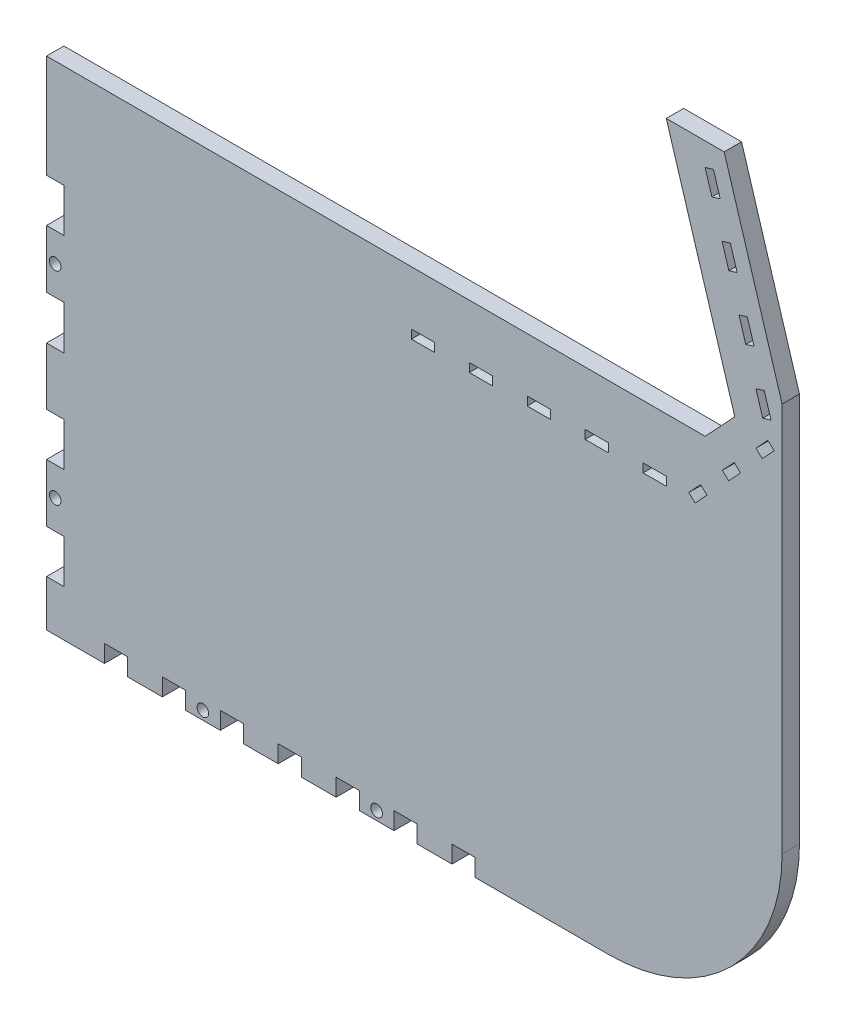
from build123d import *

# Parameters (mm, degrees)
ESQUISSE1_W              = 340
ESQUISSE1_H              = 260
BOSS_EXTRU_1_DEPTH       = 6
CONG_1_R                 = 60
ESQUISSE14_W             = 180
ESQUISSE14_H             = 10
ENL_V_MAT_EXTRU_7_DEPTH  = 10
ESQUISSE15_W             = 120
ESQUISSE15_H             = 2
ENL_V_MAT_EXTRU_8_DEPTH  = 10
CONG_2_R                 = 10
CONG_3_R                 = 8
ENL_V_MAT_EXTRU_10_DEPTH = 10
ESQUISSE18_W             = 8
ESQUISSE18_H             = 6
ENL_V_MAT_EXTRU_11_DEPTH = 10
ENL_V_MAT_EXTRU_13_DEPTH = 6
ENL_V_MAT_EXTRU_14_DEPTH = 10
ESQUISSE21_W             = 95
ESQUISSE21_H             = 171.650635095
ENL_V_MAT_EXTRU_15_DEPTH = 10
BOSS_EXTRU_3_DEPTH       = 6
ENL_V_MAT_EXTRU_18_DEPTH = 6
ESQUISSE25_W             = 8
ESQUISSE25_H             = 3
ENL_V_MAT_EXTRU_17_DEPTH = 6
ESQUISSE30_W             = 9
ESQUISSE30_H             = 171.650635095
BOSS_EXTRU_4_DEPTH       = 6
ESQUISSE32_W             = 6
ESQUISSE32_H             = 15
ESQUISSE32_H_2           = 15.174682453
ENL_V_MAT_EXTRU_19_DEPTH = 6
ESQUISSE33_R             = 2
ENL_V_MAT_EXTRU_20_DEPTH = 364.527165422


with BuildPart() as part:
    # Esquisse1 → Boss.-Extru.1 (new body)
    with BuildSketch(Plane.XY):
        with Locations((-170, 130)):
            Rectangle(ESQUISSE1_W, ESQUISSE1_H)
    extrude(amount=-BOSS_EXTRU_1_DEPTH)

    # Congé1
    cong_1_edges = [part.edges().sort_by_distance(p)[0] for p in [
        (0, 0, -3),
        (-340, 0, -3),
    ]]
    fillet(cong_1_edges, radius=CONG_1_R)

    # Esquisse14 → Enlèv. mat.-Extru.7 (cut)
    with BuildSketch(Plane(origin=(0, 0, -6), x_dir=(-1, 0, 0), z_dir=(0, 0, -1))):
        with Locations((235, 255)):
            Rectangle(ESQUISSE14_W, ESQUISSE14_H)
    extrude(amount=-ENL_V_MAT_EXTRU_7_DEPTH, mode=Mode.SUBTRACT)

    # Esquisse15 → Enlèv. mat.-Extru.8 (cut)
    with BuildSketch(Plane.XY):
        with Locations((-250, 249)):
            Rectangle(ESQUISSE15_W, ESQUISSE15_H)
    extrude(amount=-ENL_V_MAT_EXTRU_8_DEPTH, mode=Mode.SUBTRACT)

    # Congé2
    # the kernel refuses this fillet: 10 mm, written as the material it takes off along each edge
    with BuildSketch(Plane(origin=(-190, 250, 15), x_dir=(1, 0, 0), z_dir=(0, 0, -1))) as cong_2_piece_1:
        with BuildLine():
            CenterArc((6, 10), CONG_2_R, 233.130102354, 36.869897646)
            Line((0, 2), (-0.12, 1.84))
            ThreePointArc((-0.12, 1.84), (-0.2, 1), (-0.2, 0))
            Line((-0.2, 0), (0, -0.2))
            Line((0, -0.2), (6, -0.2))
            Line((6, -0.2), (6, 0))
        make_face()
    extrude(amount=36, mode=Mode.SUBTRACT)
    with BuildSketch(Plane(origin=(-310, 250, 15), x_dir=(0, -1, 0), z_dir=(0, 0, -1))) as cong_2_piece_2:
        with BuildLine():
            CenterArc((10, 6), CONG_2_R, 180, 36.869897646)
            Line((0, 6), (-0.2, 6))
            Line((-0.2, 6), (-0.2, 0))
            Line((-0.2, 0), (0, -0.2))
            ThreePointArc((0, -0.2), (1, -0.2), (1.84, -0.12))
            Line((1.84, -0.12), (2, 0))
        make_face()
    extrude(amount=36, mode=Mode.SUBTRACT)

    # Congé3
    cong_3_edges = [part.edges().sort_by_distance(p)[0] for p in [
        (-145, 260, -3),
        (-325, 260, -3),
    ]]
    fillet(cong_3_edges, radius=CONG_3_R)

    # Esquisse17 → Enlèv. mat.-Extru.10 (cut)
    with BuildSketch(Plane.XY):
        Polygon((-29.216285169, 245.39755551), (-23.478456633, 247.151785738), (-25.817430271, 254.802223786), (-31.555258806, 253.047993558), align=None)
        Polygon((-23.368851074, 226.271460391), (-17.631022538, 228.025690619), (-19.969996176, 235.676128667), (-25.707824712, 233.921898438), align=None)
        Polygon((-17.52141698, 207.145365271), (-11.783588444, 208.8995955), (-14.122562082, 216.550033547), (-19.860390617, 214.795803319), align=None)
        Polygon((-180, 150), (-30, 150), (-2.720065597, 179.254148065), (-9.568281369, 188.663047712), (-5.936154349, 189.77350038), (-8.275127987, 197.423938428), (-14.012956523, 195.6697082), (-13.538488979, 194.117794792), (-102.15398245, 315.868381088), (-205, 193.301270189), align=None)
    extrude(amount=-ENL_V_MAT_EXTRU_10_DEPTH, mode=Mode.SUBTRACT)

    # Esquisse18 → Enlèv. mat.-Extru.11 (cut)
    with BuildSketch(Plane.XY):
        with Locations((-110, 3)):
            Rectangle(ESQUISSE18_W, ESQUISSE18_H)
        with Locations((-130, 3)):
            Rectangle(ESQUISSE18_W, ESQUISSE18_H)
        with Locations((-150, 3)):
            Rectangle(ESQUISSE18_W, ESQUISSE18_H)
        with Locations((-170, 3)):
            Rectangle(ESQUISSE18_W, ESQUISSE18_H)
        with Locations((-190, 3)):
            Rectangle(ESQUISSE18_W, ESQUISSE18_H)
        with Locations((-210, 3)):
            Rectangle(ESQUISSE18_W, ESQUISSE18_H)
        with Locations((-230, 3)):
            Rectangle(ESQUISSE18_W, ESQUISSE18_H)
    extrude(amount=-ENL_V_MAT_EXTRU_11_DEPTH, mode=Mode.SUBTRACT)

    # Esquisse19 → Enlèv. mat.-Extru.13 (cut)
    with BuildSketch(Plane.XY):
        Polygon((-27.406549935, 260), (-61.490489073, 260), (-13.538488979, 194.117794792), (-14.012956523, 195.6697082), (-8.275127987, 197.423938428), (-5.936154349, 189.77350038), (-9.568281369, 188.663047712), (-2.720065597, 179.254148065), (0, 179.254148065), (0, 193.164126288), (0, 260), align=None)
        Polygon((-19.860390617, 214.795803319), (-14.122562082, 216.550033547), (-11.783588444, 208.8995955), (-17.52141698, 207.145365271), align=None, mode=Mode.SUBTRACT)
        Polygon((-25.707824712, 233.921898438), (-19.969996176, 235.676128667), (-17.631022538, 228.025690619), (-23.368851074, 226.271460391), align=None, mode=Mode.SUBTRACT)
        Polygon((-23.478456633, 247.151785738), (-29.216285169, 245.39755551), (-31.555258806, 253.047993558), (-25.817430271, 254.802223786), align=None, mode=Mode.SUBTRACT)
    extrude(amount=-ENL_V_MAT_EXTRU_13_DEPTH, mode=Mode.SUBTRACT)

    # Esquisse20 → Enlèv. mat.-Extru.14 (cut)
    with BuildSketch(Plane.XY):
        Polygon((-192.5, 171.650635095), (-340, 171.650635095), (-340, 260), (-157.424116728, 260.642727797), (-157.424116728, 250), align=None)
    extrude(amount=-ENL_V_MAT_EXTRU_14_DEPTH, mode=Mode.SUBTRACT)

    # Esquisse21 → Enlèv. mat.-Extru.15 (cut)
    with BuildSketch(Plane.XY):
        with Locations((-292.5, 85.825317548)):
            Rectangle(ESQUISSE21_W, ESQUISSE21_H)
    extrude(amount=-ENL_V_MAT_EXTRU_15_DEPTH, mode=Mode.SUBTRACT)

    # Esquisse27 → Boss.-Extru.3 (add)
    with BuildSketch(Plane.XY):
        Polygon((0, 179.254148065), (0, 194.58294763), (-20, 260), (-40, 260), (-192.5, 171.650635095), (-180, 150), (-30, 150), align=None)
    extrude(amount=-BOSS_EXTRU_3_DEPTH)

    # Esquisse29 → Enlèv. mat.-Extru.18 (cut)
    with BuildSketch(Plane.XY):
        Polygon((-40, 260), (-16.342847445, 182.620940619), (-26.572822846, 171.650635095), (-192.5, 171.650635095), align=None)
    extrude(amount=-ENL_V_MAT_EXTRU_18_DEPTH, mode=Mode.SUBTRACT)

    # Esquisse25 → Enlèv. mat.-Extru.17 (cut)
    with BuildSketch(Plane.XY):
        with Locations((-124, 151.5)):
            Rectangle(ESQUISSE25_W, ESQUISSE25_H)
        with Locations((-104, 151.5)):
            Rectangle(ESQUISSE25_W, ESQUISSE25_H)
        with Locations((-84, 151.5)):
            Rectangle(ESQUISSE25_W, ESQUISSE25_H)
        with Locations((-64, 151.5)):
            Rectangle(ESQUISSE25_W, ESQUISSE25_H)
        with Locations((-44, 151.5)):
            Rectangle(ESQUISSE25_W, ESQUISSE25_H)
        Polygon((-32.225134911, 152.012672503), (-28.133144751, 156.400794713), (-25.939083646, 154.354799632), (-30.031073806, 149.966677423), align=None)
        Polygon((-20.63116279, 164.44568543), (-18.437101685, 162.39969035), (-14.345111525, 166.78781256), (-16.53917263, 168.83380764), align=None)
        Polygon((-6.843129564, 174.832703278), (-9.037190669, 176.878698358), (-4.945200508, 181.266820568), (-2.751139404, 179.220825487), align=None)
        Polygon((-9.038404375, 194.655087151), (-6.169490107, 195.532202265), (-3.830516469, 187.881764218), (-6.699430737, 187.004649103), align=None)
        Polygon((-9.677950563, 207.007859337), (-12.546864831, 206.130744223), (-14.885838469, 213.78118227), (-12.016924201, 214.658297384), align=None)
        Polygon((-18.394298926, 225.256839342), (-15.525384658, 226.133954456), (-17.864358296, 233.784392504), (-20.733272563, 232.90727739), align=None)
        Polygon((-21.372818752, 245.260049575), (-23.71179239, 252.910487623), (-26.580706658, 252.033372509), (-24.24173302, 244.382934461), align=None)
    extrude(amount=-ENL_V_MAT_EXTRU_17_DEPTH, mode=Mode.SUBTRACT)

    # Esquisse30 → Boss.-Extru.4 (add)
    with BuildSketch(Plane.XY):
        with Locations((-249.5, 85.825317548)):
            Rectangle(ESQUISSE30_W, ESQUISSE30_H)
    extrude(amount=-BOSS_EXTRU_4_DEPTH)

    # Esquisse32 → Enlèv. mat.-Extru.19 (cut)
    with BuildSketch(Plane.XY):
        with Locations((-251, 128.5)):
            Rectangle(ESQUISSE32_W, ESQUISSE32_H)
        with Locations((-251, 93.412658773)):
            Rectangle(ESQUISSE32_W, ESQUISSE32_H_2)
        with Locations((-251, 58.5)):
            Rectangle(ESQUISSE32_W, ESQUISSE32_H)
        with Locations((-251, 23.5)):
            Rectangle(ESQUISSE32_W, ESQUISSE32_H)
    extrude(amount=-ENL_V_MAT_EXTRU_19_DEPTH, mode=Mode.SUBTRACT)

    # Esquisse33 → Enlèv. mat.-Extru.20 (cut, through all)
    with BuildSketch(Plane.XY):
        with Locations((-200, 3)):
            Circle(ESQUISSE33_R)
        with Locations((-140, 3)):
            Circle(ESQUISSE33_R)
        with Locations((-251, 41)):
            Circle(ESQUISSE33_R)
        with Locations((-251, 111)):
            Circle(ESQUISSE33_R)
    extrude(amount=-ENL_V_MAT_EXTRU_20_DEPTH, mode=Mode.SUBTRACT)


solid = part.part
